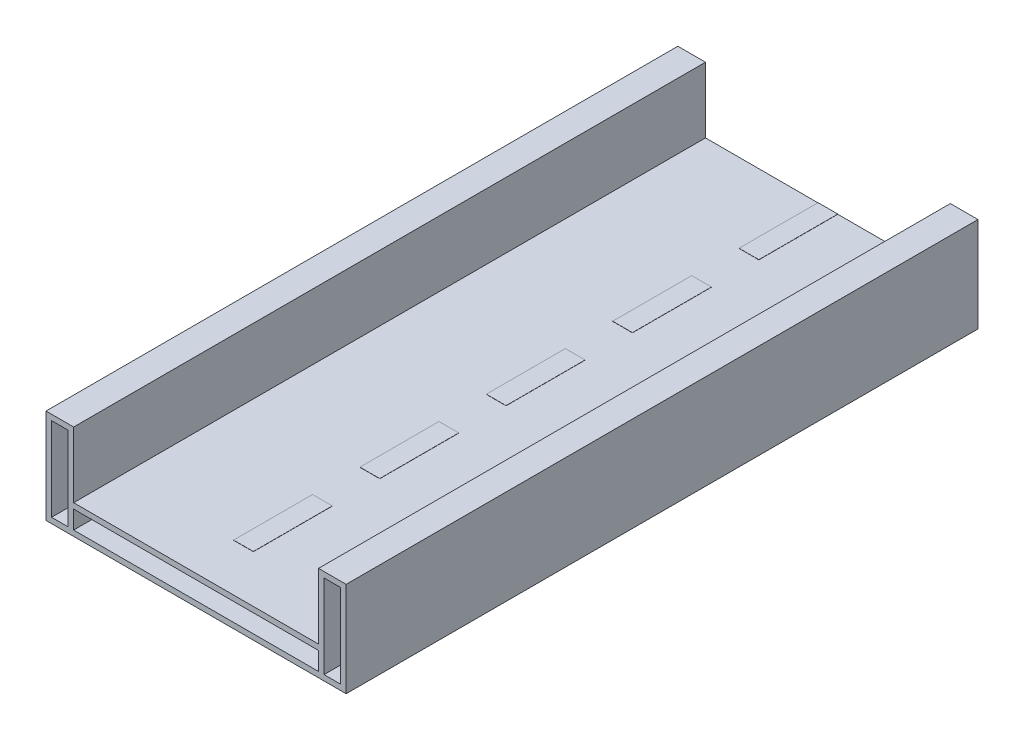
from build123d import *

# Parameters (mm, degrees)
EXTRUDE_THIN1_OUTLINE_W   = 3100
EXTRUDE_THIN1_OUTLINE_H   = 230
EXTRUDE_THIN1_OUTLINE_W_2 = 210
EXTRUDE_THIN1_OUTLINE_H_2 = 1060
EXTRUDE_THIN1_DEPTH       = 8000
SKETCH4_W                 = 250
SKETCH4_H                 = 1000
BOSS_EXTRUDE2_DEPTH       = 2.5
LPATTERN1_COUNT           = 5
LPATTERN1_PITCH           = 1600


# Read off the part's stored shape, not the designer's step: Extrude-Thin1
with BuildPart() as part:
    # Extrude-Thin1 outline → Extrude-Thin1 (new body)
    with BuildSketch(Plane.XY):
        Polygon((-1900, 1050), (-1900, -150), (1900, -150), (1900, 1050), (1550, 1050), (1550, 220), (-1550, 220), (-1550, 1050), align=None)
        with Locations((0, 35)):
            Rectangle(EXTRUDE_THIN1_OUTLINE_W, EXTRUDE_THIN1_OUTLINE_H, mode=Mode.SUBTRACT)
        with Locations((-1725, 450)):
            Rectangle(EXTRUDE_THIN1_OUTLINE_W_2, EXTRUDE_THIN1_OUTLINE_H_2, mode=Mode.SUBTRACT)
        with Locations((1725, 450)):
            Rectangle(EXTRUDE_THIN1_OUTLINE_W_2, EXTRUDE_THIN1_OUTLINE_H_2, mode=Mode.SUBTRACT)
    extrude(amount=EXTRUDE_THIN1_DEPTH)

    # Sketch4 → Boss-Extrude2 (add)
    with BuildSketch(Plane(origin=(0, 220, 0), x_dir=(1, 0, 0), z_dir=(0, 1, 0))):
        with Locations((0, -500)):
            Rectangle(SKETCH4_W, SKETCH4_H)
    boss_extrude2 = extrude(amount=BOSS_EXTRUDE2_DEPTH)

    # LPattern1: Boss-Extrude2 ×5
    with Locations(*[(0, 0, i * LPATTERN1_PITCH) for i in range(1, LPATTERN1_COUNT)]):
        add(boss_extrude2)


solid = part.part
